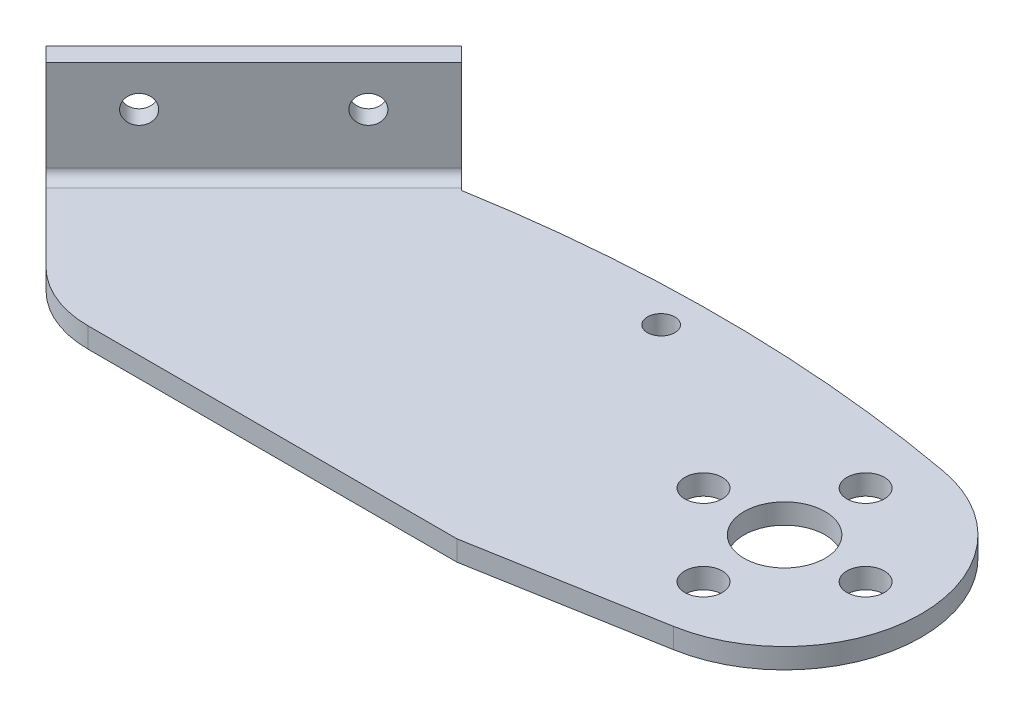
from build123d import *

# Parameters (mm, degrees)
SKETCH1_R                  = 1.85
SKETCH1_R_2                = 4
BOSS_EXTRUDE1_DEPTH        = 2
BOSS_EXTRUDE3_DEPTH        = 10
SKETCH12_R                 = 1.36525
CUT_EXTRUDE2_DEPTH         = 3
SKETCH14_R                 = 1.35255
CUT_EXTRUDE3_DEPTH         = 6
FILLET1_R                  = 10
FLATTEN_BENDS1_START       = 2
FLATTEN_BENDS1_DEPTH       = 10
FLATTEN_BENDS1_2_OUTLINE_R = 1.36525
FLATTEN_BENDS1_2_DEPTH     = 2
PROCESS_BENDS1_START       = -8.401979777
PROCESS_BENDS1_OUTLINE_W   = 29
PROCESS_BENDS1_OUTLINE_H   = 2
PROCESS_BENDS1_DEPTH       = 8.701769682
PROCESS_BENDS1_START_2     = 0.591569905
PROCESS_BENDS1_2_OUTLINE_W = 29
PROCESS_BENDS1_2_OUTLINE_H = 10
PROCESS_BENDS1_2_OUTLINE_R = 1.36525
PROCESS_BENDS1_2_DEPTH     = 1.70822
PROCESS_BENDS1_START_3     = 0.299789905
PROCESS_BENDS1_3_OUTLINE_W = 29
PROCESS_BENDS1_3_OUTLINE_H = 10
PROCESS_BENDS1_3_OUTLINE_R = 1.36525
PROCESS_BENDS1_3_DEPTH     = 3
PROCESS_BENDS1_START_4     = -6.292093187
PROCESS_BENDS1_4_DEPTH     = 29


with BuildPart() as part:
    # Sketch1 → Boss-Extrude1 (new body)
    with BuildSketch(Plane(origin=(0, 2, 0), x_dir=(1, 0, 0), z_dir=(0, 1, 0))):
        with BuildLine():
            Line((16.268898369, 15.844931419), (-4.237198285, -4.661165235))
            Line((-4.237198285, -4.661165235), (7.60163648, -16.5))
            Line((7.60163648, -16.5), (48.167251499, -16.5))
            Line((48.167251499, -16.5), (66.344250399, -13.294904666))
            ThreePointArc((66.344250399, -13.294904666), (77.499939542, -0.040402458), (66.423785357, 13.280634945))
            ThreePointArc((66.423785357, 13.280634945), (42.528480772, 15.498562339), (18.613829789, 13.5))
            Line((18.613829789, 13.5), (16.268898369, 15.844931419))
        make_face()
        with Locations(Location((56, 0, 0), (0, 0, 90))):
            Circle(SKETCH1_R, mode=Mode.SUBTRACT)
        with Locations(Location((64, -8, 0), (0, 0, 90))):
            Circle(SKETCH1_R, mode=Mode.SUBTRACT)
        with Locations(Location((72, 0, 0), (0, 0, 90))):
            Circle(SKETCH1_R, mode=Mode.SUBTRACT)
        with Locations(Location((64, 8, 0), (0, 0, 90))):
            Circle(SKETCH1_R, mode=Mode.SUBTRACT)
        with Locations(Location((64, 0, 0), (0, 0, 90))):
            Circle(SKETCH1_R_2, mode=Mode.SUBTRACT)
    extrude(amount=-BOSS_EXTRUDE1_DEPTH)

    # Sketch5 → Boss-Extrude3 (add)
    with BuildSketch(Plane(origin=(0, 2, 0), x_dir=(1, 0, 0), z_dir=(0, 1, 0))):
        Polygon((16.268898369, 15.844931419), (-4.237198285, -4.661165235), (-2.822984723, -6.075378798), (17.683111932, 14.430717857), align=None)
    extrude(amount=BOSS_EXTRUDE3_DEPTH)

    # Sketch12 → Cut-Extrude2 (cut)
    with BuildSketch(Plane(origin=(0.211983475, 0, 0.211983475), x_dir=(-0.7071067811865475, 0, 0.7071067811865477), z_dir=(-0.7071067811865477, 0, -0.7071067811865475))):
        with Locations((-16.207906813, 8)):
            Circle(SKETCH12_R)
        with Locations((-0.207906813, 8)):
            Circle(SKETCH12_R)
    extrude(amount=-CUT_EXTRUDE2_DEPTH, mode=Mode.SUBTRACT)

    # Sketch14 → Cut-Extrude3 (cut)
    with BuildSketch(Plane(origin=(0, 0, 0), x_dir=(1, 0, 0), z_dir=(0, 1, 0))):
        with Locations(Location((39.946755384, 11.867587507, 0), (0, 0, 270))):
            Circle(SKETCH14_R)
    extrude(amount=CUT_EXTRUDE3_DEPTH, mode=Mode.SUBTRACT)

    # Fillet1
    fillet1_edges = [part.edges().sort_by_distance(p)[0] for p in [
        (7.60163648, 1, 16.5),
    ]]
    fillet(fillet1_edges, radius=FILLET1_R)

    # Flatten-Bends1: read off the stored shape, not the designer's step
    # Flatten-Bends1 outline → Flatten-Bends1 (cut)
    with BuildSketch(Plane(origin=(0, 0, 0), x_dir=(1, 0, 0), z_dir=(0, 1, 0)).offset(FLATTEN_BENDS1_START)):
        Polygon((17.683111932, 14.430717857), (16.479779049, 15.634050739), (16.268898369, 15.844931419), (-4.237198285, -4.661165235), (-4.026317605, -4.872045915), (-2.822984722, -6.075378798), align=None)
    extrude(amount=FLATTEN_BENDS1_DEPTH, mode=Mode.SUBTRACT)

    # Flatten-Bends1 2 outline → Flatten-Bends1 2 (add)
    with BuildSketch(Plane(origin=(0, 0, 0), x_dir=(1, 0, 0), z_dir=(0, 1, 0))):
        Polygon((-4.237198285, -4.661165235), (16.268898369, 15.844931419), (10.115818019, 21.99801177), (-10.390278636, 1.491915115), align=None)
        with Locations((-2.965657433, 3.259682068)):
            Circle(FLATTEN_BENDS1_2_OUTLINE_R, mode=Mode.SUBTRACT)
        with Locations((8.348051066, 14.573390567)):
            Circle(FLATTEN_BENDS1_2_OUTLINE_R, mode=Mode.SUBTRACT)
    extrude(amount=FLATTEN_BENDS1_2_DEPTH)

    # Process-Bends1: read off the stored shape, not the designer's step
    # Process-Bends1 outline → Process-Bends1 (cut)
    with BuildSketch(Plane(origin=(0, 0, 0), x_dir=(0.7071067811865471, 0, -0.707106781186548), z_dir=(0.707106781186548, 0, 0.707106781186547)).offset(PROCESS_BENDS1_START)):
        with Locations((8.207906813, 1)):
            Rectangle(PROCESS_BENDS1_OUTLINE_W, PROCESS_BENDS1_OUTLINE_H)
    extrude(amount=PROCESS_BENDS1_DEPTH, mode=Mode.SUBTRACT)

    # Process-Bends1 2 outline → Process-Bends1 2 (add)
    with BuildSketch(Plane(origin=(0, 0, 0), x_dir=(0.7071067811865471, 0, -0.707106781186548), z_dir=(0.707106781186548, 0, 0.707106781186547)).offset(PROCESS_BENDS1_START_2)):
        with Locations((8.207906813, 7)):
            Rectangle(PROCESS_BENDS1_2_OUTLINE_W, PROCESS_BENDS1_2_OUTLINE_H)
        with Locations((0.207906813, 8)):
            Circle(PROCESS_BENDS1_2_OUTLINE_R, mode=Mode.SUBTRACT)
        with Locations((16.207906813, 8)):
            Circle(PROCESS_BENDS1_2_OUTLINE_R, mode=Mode.SUBTRACT)
    extrude(amount=PROCESS_BENDS1_2_DEPTH)

    # Process-Bends1 3 outline → Process-Bends1 3 (add)
    with BuildSketch(Plane(origin=(0, 0, 0), x_dir=(0.7071067811865471, 0, -0.707106781186548), z_dir=(0.707106781186548, 0, 0.707106781186547)).offset(PROCESS_BENDS1_START_3)):
        with Locations((8.207906813, 7)):
            Rectangle(PROCESS_BENDS1_3_OUTLINE_W, PROCESS_BENDS1_3_OUTLINE_H)
        with Locations((0.207906813, 8)):
            Circle(PROCESS_BENDS1_3_OUTLINE_R, mode=Mode.SUBTRACT)
        with Locations((16.207906813, 8)):
            Circle(PROCESS_BENDS1_3_OUTLINE_R, mode=Mode.SUBTRACT)
    extrude(amount=PROCESS_BENDS1_3_DEPTH)

    # Process-Bends1 4 outline → Process-Bends1 4 (cut)
    with BuildSketch(Plane(origin=(0, 0, 0), x_dir=(0.7071067811865474, 0, 0.7071067811865477), z_dir=(0.7071067811865476, 0, -0.7071067811865476)).offset(PROCESS_BENDS1_START_4)):
        with BuildLine():
            ThreePointArc((3.299789905, -2), (2.592683124, -2.292893219), (2.299789905, -3))
            Line((2.299789905, -3), (2.299789905, -12))
            Line((2.299789905, -12), (3.299789905, -12))
            Line((3.299789905, -12), (3.299789905, -2))
        make_face()
        with BuildLine():
            Line((0.299789905, 0), (0.299789905, -3))
            ThreePointArc((0.299789905, -3), (1.178469562, -0.878679657), (3.299789905, 0))
            Line((3.299789905, 0), (0.299789905, 0))
        make_face()
    extrude(amount=PROCESS_BENDS1_4_DEPTH, mode=Mode.SUBTRACT)


solid = part.part
